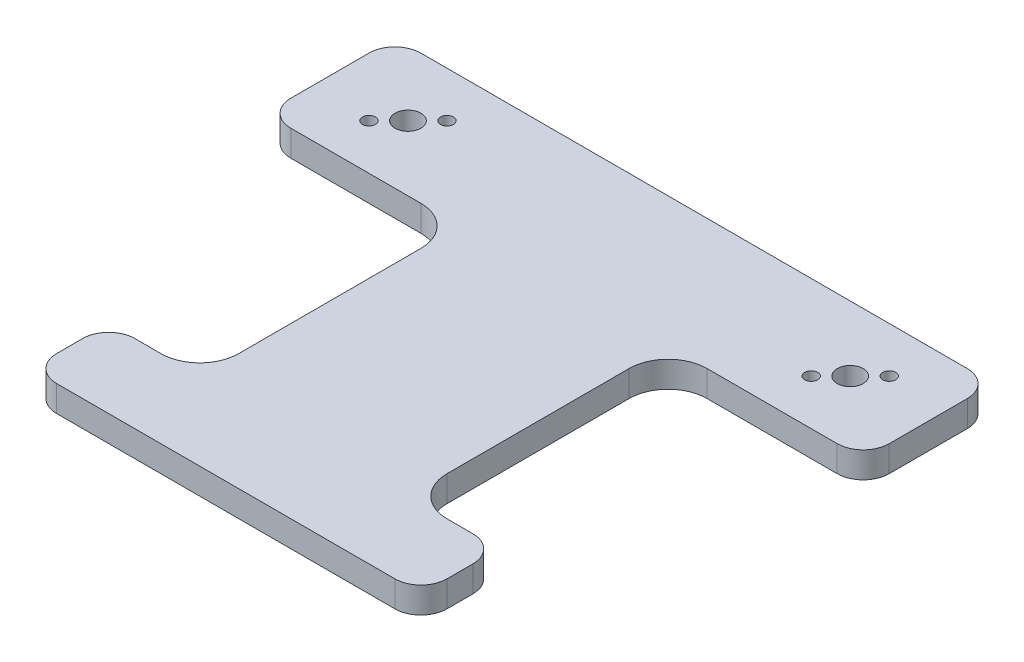
from build123d import *

# Parameters (mm, degrees)
AUFSATZ_LINEAR_AUSTRAGEN1_DEPTH  = 10
F_10_0_10_DURCHMESSER_BOHRUNG1_D = 10
F_5_0_5_DURCHMESSER_BOHRUNG1_D   = 5


with BuildPart() as part:
    # Skizze1 → Aufsatz-Linear austragen1 (new body)
    with BuildSketch(Plane(origin=(0, 0, 0), x_dir=(1, 0, 0), z_dir=(0, 1, 0))):
        with BuildLine():
            Line((-105, 90), (105, 90))
            ThreePointArc((105, 90), (112.071067812, 87.071067812), (115, 80))
            Line((115, 80), (115, 50))
            ThreePointArc((115, 50), (112.071067812, 42.928932188), (105, 40))
            Line((105, 40), (55, 40))
            ThreePointArc((55, 40), (44.393398282, 35.606601718), (40, 25))
            Line((40, 25), (40, -45))
            ThreePointArc((40, -45), (44.393398282, -55.606601718), (55, -60))
            Line((55, -60), (65, -60))
            ThreePointArc((65, -60), (72.071067812, -62.928932188), (75, -70))
            Line((75, -70), (75, -80))
            ThreePointArc((75, -80), (72.071067812, -87.071067812), (65, -90))
            Line((65, -90), (-65, -90))
            ThreePointArc((-65, -90), (-72.071067812, -87.071067812), (-75, -80))
            Line((-75, -80), (-75, -70))
            ThreePointArc((-75, -70), (-72.071067812, -62.928932188), (-65, -60))
            Line((-65, -60), (-55, -60))
            ThreePointArc((-55, -60), (-44.393398282, -55.606601718), (-40, -45))
            Line((-40, -45), (-40, 25))
            ThreePointArc((-40, 25), (-44.393398282, 35.606601718), (-55, 40))
            Line((-55, 40), (-105, 40))
            ThreePointArc((-105, 40), (-112.071067812, 42.928932188), (-115, 50))
            Line((-115, 50), (-115, 80))
            ThreePointArc((-115, 80), (-112.071067812, 87.071067812), (-105, 90))
        make_face()
    extrude(amount=AUFSATZ_LINEAR_AUSTRAGEN1_DEPTH)

    # Ø10.0 (10) Durchmesser Bohrung1 (through all)
    with Locations(Plane(origin=(0, 10, 0), x_dir=(1, 0, 0), z_dir=(0, 1, 0))):
        with Locations((-85, 65), (85, 65)):
            Hole(F_10_0_10_DURCHMESSER_BOHRUNG1_D / 2)

    # Ø5.0 (5) Durchmesser Bohrung1 (through all)
    with Locations(Plane(origin=(0, 0, 0), x_dir=(-1, 0, 0), z_dir=(0, -1, 0))):
        with Locations((77.5, 72.5), (92.5, 57.5), (-92.5, 72.5), (-77.5, 57.5)):
            Hole(F_5_0_5_DURCHMESSER_BOHRUNG1_D / 2)


solid = part.part
